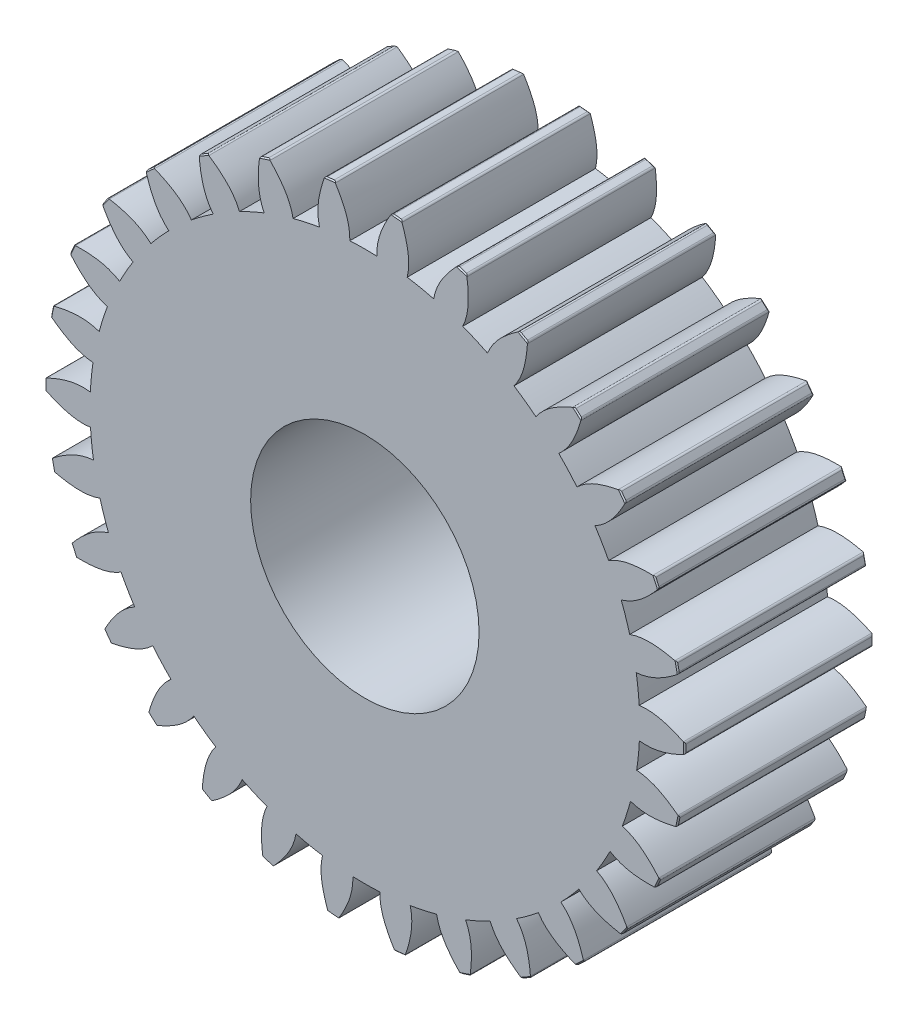
from build123d import *

# Parameters (mm, degrees)
BOSS_EXTRUDE1_DEPTH          = 32.97
CHAMFER1_SIZE                = 0.2
FILLET1_R                    = 0.4
CIRPATTERN1_COUNT            = 30
CHAMFER1_OF_CIRPATTERN1_SIZE = 0.2
FILLET1_OF_CIRPATTERN1_R     = 0.4
SKETCH2_R                    = 20
CUT_EXTRUDE1_DEPTH           = 86.64391168


with BuildPart() as part:
    # Sketch1 → Boss-Extrude1 (new body)
    with BuildSketch(Plane.XY):
        with BuildLine():
            add(Edge.make_bspline(
                [(-2.630353738, 48.053063006), (-2.613997299, 48.647630733), (-2.658156288, 49.229445147), (-2.7514424, 49.79904808)],
                knots=[-0.089036756, -0.089036756, -0.089036756, -0.089036756, 0, 0, 0, 0], degree=3))
            ThreePointArc((-2.7514424, 49.79904808), (-5.486389197, 49.572322505), (-8.204725102, 49.195509053))
            add(Edge.make_bspline(
                [(-7.941087965, 47.465300451), (-8.087062938, 48.04190224), (-8.171198258, 48.619292296), (-8.204725102, 49.195509053)],
                knots=[-0.089036756, -0.089036756, -0.089036756, -0.089036756, 0, 0, 0, 0], degree=3))
            ThreePointArc((-7.941087965, 47.465300451), (-5.293884313, 47.832942768), (-2.630353738, 48.053063006))
        make_face()
        with BuildLine():
            ThreePointArc((-8.204725102, 49.195509053), (-5.486389197, 49.572322505), (-2.7514424, 49.79904808))
            add(Edge.make_bspline(
                [(-2.7514424, 49.79904808), (-2.817014675, 50.199430938), (-3.176031867, 51.775226489), (-4.093253603, 53.764767051), (-5.000627252, 55.282787283), (-5.29937182, 55.748691987)],
                knots=[0, 0, 0, 0, 0.062585336, 0.250087164, 0.335630559, 0.335630559, 0.335630559, 0.335630559], degree=3))
            ThreePointArc((-5.29937182, 55.748691987), (-6.160156292, 55.660151585), (-7.01946989, 55.558321091))
            add(Edge.make_bspline(
                [(-8.204725102, 49.195509053), (-8.228291648, 49.600540872), (-8.222543002, 51.216706678), (-7.762572848, 53.358667186), (-7.209104891, 55.03836525), (-7.01946989, 55.558321091)],
                knots=[0, 0, 0, 0, 0.062585336, 0.250087164, 0.335630559, 0.335630559, 0.335630559, 0.335630559], degree=3))
        make_face()
        with BuildLine():
            ThreePointArc((48.125, 0), (33.086476477, 34.94711289), (-2.630353738, 48.053063006))
            ThreePointArc((-2.630353738, 48.053063006), (-5.293884313, 47.832942768), (-7.941087965, 47.465300451))
            ThreePointArc((-7.941087965, 47.465300451), (-31.095423833, -36.729963812), (48.125, 0))
        make_face()
    boss_extrude1 = extrude(amount=BOSS_EXTRUDE1_DEPTH)

    # Chamfer1
    chamfer1_edges = [part.edges().sort_by_distance(p)[0] for p in [
        (-6.160156292, 55.660151585, 32.97),
        (-6.160156292, 55.660151585, 0),
    ]]
    chamfer(chamfer1_edges, length=CHAMFER1_SIZE)

    # Fillet1
    # the kernel refuses this fillet: 0.4 mm, written as the material it takes off along each edge
    with BuildSketch(Plane(origin=(-5.29937182, 55.748691987, -0.419421766), x_dir=(0.5358083767405052, -0.8443396137897977, 0), z_dir=(0, 0, 1))) as fillet1_piece_1:
        with BuildLine():
            CenterArc((0.245878844, -0.399995535), FILLET1_R, 89.729296063, 63.554536848)
            ThreePointArc((-0.111418984, -0.220167111), (-0.055830758, -0.110022187), (0, 0))
            ThreePointArc((0, 0), (0.123884352, 0.000292173), (0.247768706, 0))
        make_face()
    extrude(amount=33.808843532, mode=Mode.SUBTRACT)
    with BuildSketch(Plane(origin=(-7.01946989, 55.558321091, -0.419421766), x_dir=(-0.3382090502986817, -0.9410710059799228, 0), z_dir=(0, 0, 1))) as fillet1_piece_2:
        with BuildLine():
            CenterArc((0.245878844, 0.399995535), FILLET1_R, 206.716167089, 63.554536848)
            ThreePointArc((-0.111418984, 0.220167111), (-0.055830758, 0.110022187), (0, 0))
            ThreePointArc((0, 0), (0.123884352, -0.000292173), (0.247768706, 0))
        make_face()
    extrude(amount=33.808843532, mode=Mode.SUBTRACT)

    # CirPattern1: Boss-Extrude1 ×30 about axis
    cirpattern1_axis = Axis((0, 0, 32.97), (0, 0, 1))
    for i in range(1, CIRPATTERN1_COUNT):
        add(boss_extrude1.rotate(cirpattern1_axis, i * 360 / CIRPATTERN1_COUNT))

    # Chamfer1 of CirPattern1
    chamfer1_of_cirpattern1_edges = [part.edges().sort_by_distance(p)[0] for p in [
        (-17.597938324, 53.163075219, 32.97),
        (-17.597938324, 53.163075219, 0),
        (-28.266606007, 48.342517361, 32.97),
        (-28.266606007, 48.342517361, 0),
        (-37.69988737, 41.409159522, 32.97),
        (-37.69988737, 41.409159522, 0),
        (-45.48550275, 32.666022708, 32.97),
        (-45.48550275, 32.666022708, 0),
        (-51.283183397, 22.495223953, 32.97),
        (-51.283183397, 22.495223953, 0),
        (-54.839542845, 11.341275967, 32.97),
        (-54.839542845, 11.341275967, 0),
        (-55.999151121, -0.308340201, 32.97),
        (-55.999151121, -0.308340201, 0),
        (-54.71132778, -11.944480421, 32.97),
        (-54.71132778, -11.944480421, 0),
        (-51.032356881, -23.058589532, 32.97),
        (-51.032356881, -23.058589532, 0),
        (-45.123027105, -33.164927632, 32.97),
        (-45.123027105, -33.164927632, 0),
        (-37.241604521, -41.821799252, 32.97),
        (-37.241604521, -41.821799252, 0),
        (-27.732545114, -48.650857562, 32.97),
        (-27.732545114, -48.650857562, 0),
        (-17.01144041, -53.353639943, 32.97),
        (-17.01144041, -53.353639943, 0),
        (-5.54685413, -55.72461224, 32.97),
        (-5.54685413, -55.72461224, 0),
        (6.160156292, -55.660151585, 32.97),
        (6.160156292, -55.660151585, 0),
        (17.597938324, -53.163075219, 32.97),
        (17.597938324, -53.163075219, 0),
        (28.266606007, -48.342517361, 32.97),
        (28.266606007, -48.342517361, 0),
        (37.69988737, -41.409159522, 32.97),
        (37.69988737, -41.409159522, 0),
        (45.48550275, -32.666022708, 32.97),
        (45.48550275, -32.666022708, 0),
        (51.283183397, -22.495223953, 32.97),
        (51.283183397, -22.495223953, 0),
        (54.839542845, -11.341275967, 32.97),
        (54.839542845, -11.341275967, 0),
        (55.999151121, 0.308340201, 32.97),
        (55.999151121, 0.308340201, 0),
        (54.71132778, 11.944480421, 32.97),
        (54.71132778, 11.944480421, 0),
        (51.032356881, 23.058589532, 32.97),
        (51.032356881, 23.058589532, 0),
        (45.123027105, 33.164927632, 32.97),
        (45.123027105, 33.164927632, 0),
        (37.241604521, 41.821799252, 32.97),
        (37.241604521, 41.821799252, 0),
        (27.732545114, 48.650857562, 32.97),
        (27.732545114, 48.650857562, 0),
        (17.01144041, 53.353639943, 32.97),
        (17.01144041, 53.353639943, 0),
        (5.54685413, 55.72461224, 32.97),
        (5.54685413, 55.72461224, 0),
    ]]
    chamfer(chamfer1_of_cirpattern1_edges, length=CHAMFER1_OF_CIRPATTERN1_SIZE)

    # Fillet1 of CirPattern1
    # the kernel refuses this fillet: 0.4 mm, written as the material it takes off along each edge
    with BuildSketch(Plane(origin=(-16.774372643, 53.428647956, -0.419421766), x_dir=(0.6996477548892409, -0.7144879418705712, 0), z_dir=(0, 0, 1)), Plane(origin=(-27.516252889, 48.77351563, -0.419421766), x_dir=(0.8329091688669157, -0.5534097183980632, 0), z_dir=(0, 0, 1)), Plane(origin=(-37.055540847, 41.98674663, -0.419421766), x_dir=(0.9297684554234903, -0.3681448346770836, 0), z_dir=(0, 0, 1)), Plane(origin=(-44.975323857, 33.364955327, -0.419421766), x_dir=(0.9859923989540029, -0.16679025512580228, 0), z_dir=(0, 0, 1)), Plane(origin=(-50.929469399, 23.284955374, -0.419421766), x_dir=(0.9991237433337585, 0.04185385892289857, 0), z_dir=(0, 0, 1)), Plane(origin=(-54.657752741, 12.187291137, -0.419421766), x_dir=(0.9685885858021869, 0.2486687584995744, 0), z_dir=(0, 0, 1)), Plane(origin=(-55.997230012, 0.556983796, -0.419421766), x_dir=(0.8957214592673612, 0.44461564008472404, 0), z_dir=(0, 0, 1)), Plane(origin=(-54.889359627, -11.097666409, -0.419421766), x_dir=(0.7837070068141229, 0.6211306846956188, 0), z_dir=(0, 0, 1)), Plane(origin=(-51.382560838, -22.26729534, -0.419421766), x_dir=(0.6374407975196399, 0.7704993378696217, 0), z_dir=(0, 0, 1)), Plane(origin=(-45.630097579, -32.463736614, -0.419421766), x_dir=(0.46331536659323735, 0.8861934727126882, 0), z_dir=(0, 0, 1)), Plane(origin=(-37.883380099, -41.241356819, -0.419421766), x_dir=(0.2689408309129265, 0.9631567003701239, 0), z_dir=(0, 0, 1)), Plane(origin=(-28.480977123, -48.216531834, -0.419421766), x_dir=(0.06281229040043598, 0.9980253584827649, 0), z_dir=(0, 0, 1)), Plane(origin=(-17.833818781, -53.084413039, -0.419421766), x_dir=(-0.14606144860938866, 0.9892755193727008, 0), z_dir=(0, 0, 1)), Plane(origin=(-6.407236981, -55.632250667, -0.419421766), x_dir=(-0.34855160143434905, 0.9372895929954363, 0), z_dir=(0, 0, 1)), Plane(origin=(5.29937182, -55.748691987, -0.419421766), x_dir=(-0.5358083767405314, 0.8443396137897812, 0), z_dir=(0, 0, 1)), Plane(origin=(16.774372643, -53.428647956, -0.419421766), x_dir=(-0.6996477548892556, 0.7144879418705568, 0), z_dir=(0, 0, 1)), Plane(origin=(27.516252889, -48.77351563, -0.419421766), x_dir=(-0.8329091688669289, 0.5534097183980433, 0), z_dir=(0, 0, 1)), Plane(origin=(37.055540847, -41.98674663, -0.419421766), x_dir=(-0.9297684554234903, 0.3681448346770836, 0), z_dir=(0, 0, 1)), Plane(origin=(44.975323857, -33.364955327, -0.419421766), x_dir=(-0.9859923989540038, 0.1667902551257976, 0), z_dir=(0, 0, 1)), Plane(origin=(50.929469399, -23.284955374, -0.419421766), x_dir=(-0.9991237433337584, -0.041853858922900965, 0), z_dir=(0, 0, 1)), Plane(origin=(54.657752741, -12.187291137, -0.419421766), x_dir=(-0.9685885858021869, -0.2486687584995744, 0), z_dir=(0, 0, 1)), Plane(origin=(55.997230012, -0.556983796, -0.419421766), x_dir=(-0.8957214592673607, -0.4446156400847251, 0), z_dir=(0, 0, 1)), Plane(origin=(54.889359627, 11.097666409, -0.419421766), x_dir=(-0.7837070068140973, -0.6211306846956511, 0), z_dir=(0, 0, 1)), Plane(origin=(51.382560838, 22.26729534, -0.419421766), x_dir=(-0.6374407975196429, -0.7704993378696193, 0), z_dir=(0, 0, 1)), Plane(origin=(45.630097579, 32.463736614, -0.419421766), x_dir=(-0.4633153665932363, -0.8861934727126888, 0), z_dir=(0, 0, 1)), Plane(origin=(37.883380099, 41.241356819, -0.419421766), x_dir=(-0.2689408309129457, -0.9631567003701187, 0), z_dir=(0, 0, 1)), Plane(origin=(28.480977123, 48.216531834, -0.419421766), x_dir=(-0.06281229040044667, -0.9980253584827642, 0), z_dir=(0, 0, 1)), Plane(origin=(17.833818781, 53.084413039, -0.419421766), x_dir=(0.14606144860938866, -0.9892755193727008, 0), z_dir=(0, 0, 1)), Plane(origin=(6.407236981, 55.632250667, -0.419421766), x_dir=(0.34855160143435543, -0.937289592995434, 0), z_dir=(0, 0, 1))) as fillet1_of_cirpattern1_piece_1:
        with BuildLine():
            CenterArc((0.245878844, -0.399995535), FILLET1_OF_CIRPATTERN1_R, 89.729296063, 63.554536848)
            ThreePointArc((-0.111418984, -0.220167111), (-0.055830758, -0.110022187), (0, 0))
            ThreePointArc((0, 0), (0.123884352, 0.000292173), (0.247768706, 0))
        make_face()
    extrude(amount=33.808843532, mode=Mode.SUBTRACT)
    with BuildSketch(Plane(origin=(-18.417302109, 52.884808622, -0.419421766), x_dir=(-0.1351587070632791, -0.9908239621168751, 0), z_dir=(0, 0, 1)), Plane(origin=(-29.010209849, 47.899976248, -0.419421766), x_dir=(0.07379872023426776, -0.9972731566084512, 0), z_dir=(0, 0, 1)), Plane(origin=(-38.335232212, 40.821685061, -0.419421766), x_dir=(0.27953078933201936, -0.9601367287086866, 0), z_dir=(0, 0, 1)), Plane(origin=(-45.984820975, 31.959290353, -0.419421766), x_dir=(0.47304602159836545, -0.8810377185171805, 0), z_dir=(0, 0, 1)), Plane(origin=(-51.624652402, 21.700121299, -0.419421766), x_dir=(0.6458868727942545, -0.7634331323384246, 0), z_dir=(0, 0, 1)), Plane(origin=(-55.008238796, 10.492552816, -0.419421766), x_dir=(0.7904993683399437, -0.6124628549178718, 0), z_dir=(0, 0, 1)), Plane(origin=(-55.987701196, -1.173590574, -0.419421766), x_dir=(0.9005632482523513, -0.4347250118145652, 0), z_dir=(0, 0, 1)), Plane(origin=(-54.520232394, -12.788442425, -0.419421766), x_dir=(0.9712681928342134, -0.23798759965292562, 0), z_dir=(0, 0, 1)), Plane(origin=(-50.66996782, -23.844377976, -0.419421766), x_dir=(0.9995240567273457, -0.030848987395210133, 0), z_dir=(0, 0, 1)), Plane(origin=(-44.605182511, -33.858199792, -0.419421766), x_dir=(0.9840959230929371, 0.17763787364146202, 0), z_dir=(0, 0, 1)), Plane(origin=(-36.590936687, -42.392255807, -0.419421766), x_dir=(0.9256580754031949, 0.3783611071989998, 0), z_dir=(0, 0, 1)), Plane(origin=(-26.977491347, -49.073566822, -0.419421766), x_dir=(0.8267645280180782, 0.5625481447938874, 0), z_dir=(0, 0, 1)), Plane(origin=(-16.185000182, -53.610127486, -0.419421766), x_dir=(0.6917374035022087, 0.7221491290557807, 0), z_dir=(0, 0, 1)), Plane(origin=(-4.685146845, -55.80366833, -0.419421766), x_dir=(0.5264780351289603, 0.8501887311219487, 0), z_dir=(0, 0, 1)), Plane(origin=(7.01946989, -55.558321091, -0.419421766), x_dir=(0.3382090502986718, 0.9410710059799263, 0), z_dir=(0, 0, 1)), Plane(origin=(18.417302109, -52.884808622, -0.419421766), x_dir=(0.135158707063265, 0.990823962116877, 0), z_dir=(0, 0, 1)), Plane(origin=(29.010209849, -47.899976248, -0.419421766), x_dir=(-0.07379872023426776, 0.9972731566084512, 0), z_dir=(0, 0, 1)), Plane(origin=(38.335232212, -40.821685061, -0.419421766), x_dir=(-0.2795307893319852, 0.9601367287086966, 0), z_dir=(0, 0, 1)), Plane(origin=(45.984820975, -31.959290353, -0.419421766), x_dir=(-0.47304602159835685, 0.8810377185171853, 0), z_dir=(0, 0, 1)), Plane(origin=(51.624652402, -21.700121299, -0.419421766), x_dir=(-0.6458868727942616, 0.7634331323384186, 0), z_dir=(0, 0, 1)), Plane(origin=(55.008238796, -10.492552816, -0.419421766), x_dir=(-0.7904993683399437, 0.6124628549178718, 0), z_dir=(0, 0, 1)), Plane(origin=(55.987701196, 1.173590574, -0.419421766), x_dir=(-0.9005632482523559, 0.43472501181455575, 0), z_dir=(0, 0, 1)), Plane(origin=(54.520232394, 12.788442425, -0.419421766), x_dir=(-0.9712681928342201, 0.2379875996528987, 0), z_dir=(0, 0, 1)), Plane(origin=(50.66996782, 23.844377976, -0.419421766), x_dir=(-0.9995240567273448, 0.030848987395241435, 0), z_dir=(0, 0, 1)), Plane(origin=(44.605182511, 33.858199792, -0.419421766), x_dir=(-0.9840959230929321, -0.1776378736414898, 0), z_dir=(0, 0, 1)), Plane(origin=(36.590936687, 42.392255807, -0.419421766), x_dir=(-0.9256580754031969, -0.37836110719899535, 0), z_dir=(0, 0, 1)), Plane(origin=(26.977491347, 49.073566822, -0.419421766), x_dir=(-0.826764528018083, -0.5625481447938803, 0), z_dir=(0, 0, 1)), Plane(origin=(16.185000182, 53.610127486, -0.419421766), x_dir=(-0.6917374035022087, -0.7221491290557807, 0), z_dir=(0, 0, 1)), Plane(origin=(4.685146845, 55.80366833, -0.419421766), x_dir=(-0.5264780351289633, -0.8501887311219468, 0), z_dir=(0, 0, 1))) as fillet1_of_cirpattern1_piece_2:
        with BuildLine():
            CenterArc((0.245878844, 0.399995535), FILLET1_OF_CIRPATTERN1_R, 206.716167089, 63.554536848)
            ThreePointArc((-0.111418984, 0.220167111), (-0.055830758, 0.110022187), (0, 0))
            ThreePointArc((0, 0), (0.123884352, -0.000292173), (0.247768706, 0))
        make_face()
    extrude(amount=33.808843532, mode=Mode.SUBTRACT)

    # Sketch2 → Cut-Extrude1 (cut, through all)
    with BuildSketch(Plane.XY.offset(32.97)):
        Circle(SKETCH2_R)
    extrude(amount=-CUT_EXTRUDE1_DEPTH, mode=Mode.SUBTRACT)


solid = part.part
